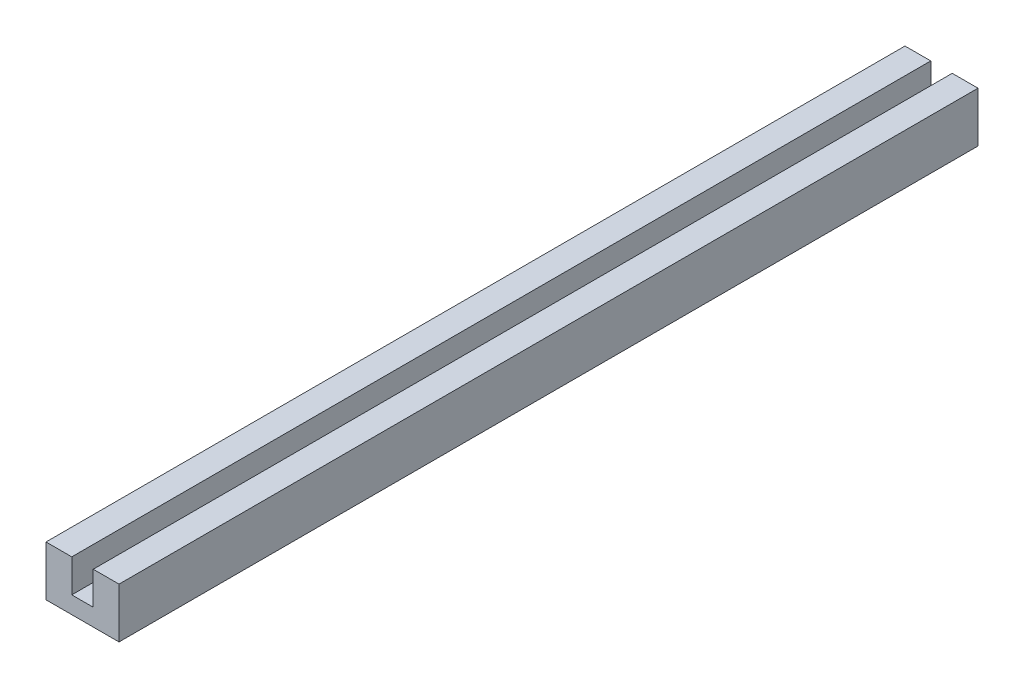
from build123d import *

# Parameters (mm, degrees)
BOSS_EXTRUDE1_DEPTH = 60


with BuildPart() as part:
    # Sketch2 → Boss-Extrude1 (new body)
    with BuildSketch(Plane.XY):
        Polygon((0, 0), (5.1, 0), (5.1, 3.5), (3.3, 3.5), (3.3, 1.2), (1.8, 1.2), (1.8, 3.5), (0, 3.5), align=None)
    extrude(amount=BOSS_EXTRUDE1_DEPTH)


solid = part.part
